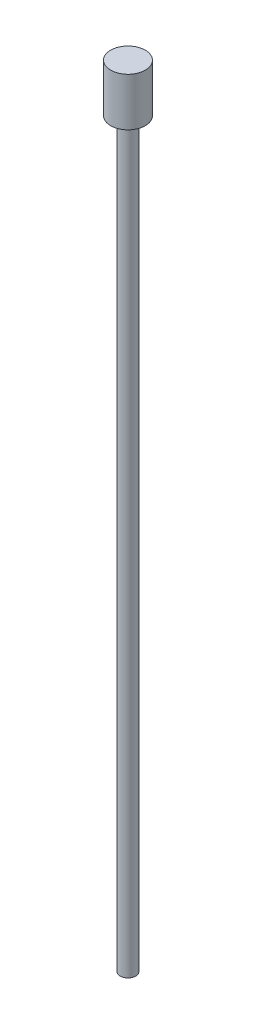
from build123d import *

# Parameters (mm, degrees)
ESQUISSE1_R        = 4
BOSS_EXTRU_1_DEPTH = 385
ESQUISSE2_R        = 9
BOSS_EXTRU_2_DEPTH = 25


with BuildPart() as part:
    # Esquisse1 → Boss.-Extru.1 (new body)
    with BuildSketch(Plane(origin=(0, 0, 0), x_dir=(1, 0, 0), z_dir=(0, 1, 0))):
        Circle(ESQUISSE1_R)
    extrude(amount=BOSS_EXTRU_1_DEPTH)

    # Esquisse2 → Boss.-Extru.2 (add)
    with BuildSketch(Plane(origin=(0, 385, 0), x_dir=(1, 0, 0), z_dir=(0, 1, 0))):
        Circle(ESQUISSE2_R)
    extrude(amount=BOSS_EXTRU_2_DEPTH)


solid = part.part
